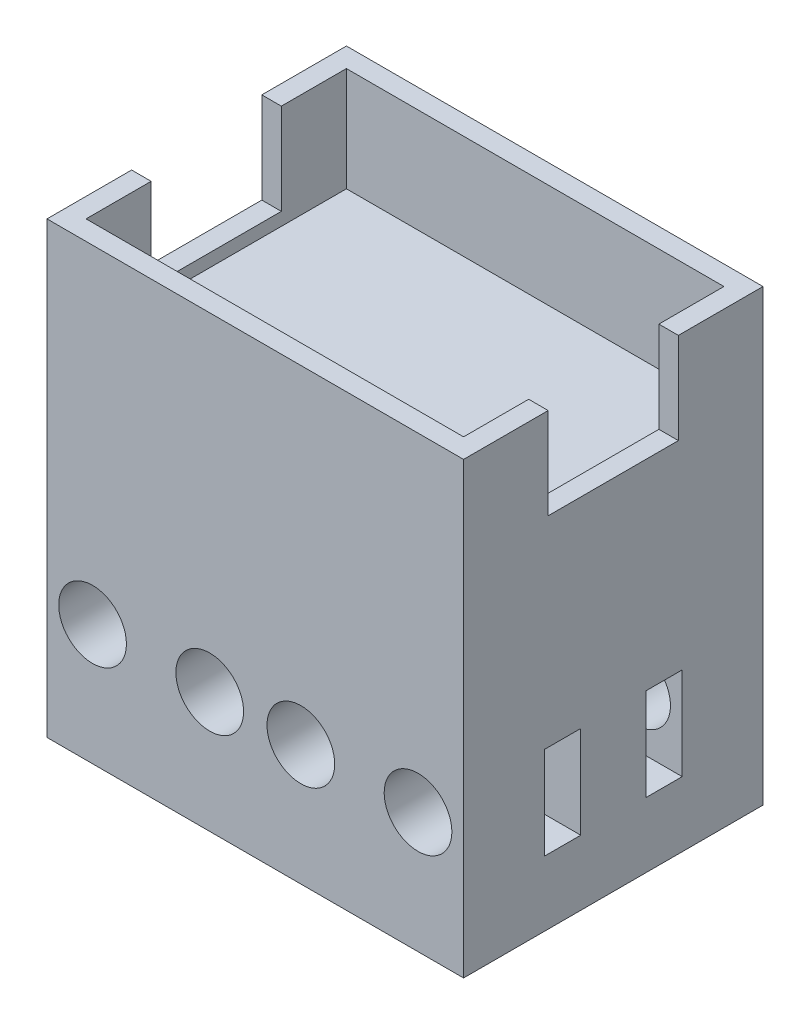
from build123d import *

# Parameters (mm, degrees)
SKETCH4_W           = 32
SKETCH4_H           = 23
BOSS_EXTRUDE3_DEPTH = 19.5
SKETCH5_W           = 29
SKETCH5_H           = 20
CUT_EXTRUDE2_DEPTH  = 8
SKETCH7_W           = 10
SKETCH7_H           = 7
CUT_EXTRUDE4_DEPTH  = 40.198214245
SKETCH8_W           = 32
SKETCH8_H           = 23
BOSS_EXTRUDE4_DEPTH = 10
SKETCH12_R          = 2.6
CUT_EXTRUDE5_DEPTH  = 7
CIRPATTERN1_COUNT   = 2
CIRPATTERN1_ANGLE   = 180
SKETCH13_W          = 15
SKETCH13_H          = 2.791622882
CUT_EXTRUDE6_DEPTH  = 7.1
SKETCH14_W          = 32
SKETCH14_H          = 23
BOSS_EXTRUDE5_DEPTH = 5


with BuildPart() as part:
    # Sketch4 → Boss-Extrude3 (new body)
    with BuildSketch(Plane(origin=(0, 0, 0), x_dir=(1, 0, 0), z_dir=(0, 1, 0))):
        Rectangle(SKETCH4_W, SKETCH4_H)
    extrude(amount=BOSS_EXTRUDE3_DEPTH)

    # Sketch5 → Cut-Extrude2 (cut)
    with BuildSketch(Plane(origin=(0, 19.5, 0), x_dir=(1, 0, 0), z_dir=(0, 1, 0))):
        Rectangle(SKETCH5_W, SKETCH5_H)
    extrude(amount=-CUT_EXTRUDE2_DEPTH, mode=Mode.SUBTRACT)

    # Sketch7 → Cut-Extrude4 (cut, through all)
    with BuildSketch(Plane(origin=(16, 0, 0), x_dir=(0, 0, -1), z_dir=(1, 0, 0))):
        with Locations((0, 16)):
            Rectangle(SKETCH7_W, SKETCH7_H)
    extrude(amount=-CUT_EXTRUDE4_DEPTH, mode=Mode.SUBTRACT)

    # Sketch8 → Boss-Extrude4 (add)
    with BuildSketch(Plane(origin=(0, 0, 0), x_dir=(-1, 0, 0), z_dir=(0, -1, 0))):
        Rectangle(SKETCH8_W, SKETCH8_H)
    extrude(amount=BOSS_EXTRUDE4_DEPTH)

    # Sketch12 → Cut-Extrude5 (cut)
    with BuildSketch(Plane(origin=(0, 0, -11.5), x_dir=(-1, 0, 0), z_dir=(0, 0, -1))):
        with Locations((-12.5, -5.726898225)):
            Circle(SKETCH12_R)
        with Locations((-3.5, -5.726898225)):
            Circle(SKETCH12_R)
        with Locations((3.5, -5.726898225)):
            Circle(SKETCH12_R)
        with Locations((12.5, -5.726898225)):
            Circle(SKETCH12_R)
    cut_extrude5 = extrude(amount=-CUT_EXTRUDE5_DEPTH, mode=Mode.SUBTRACT)

    # CirPattern1: Cut-Extrude5 ×2 about axis
    cirpattern1_axis = Axis((0, 11.5, 0), (0, 1, 0))
    for i in range(1, CIRPATTERN1_COUNT):
        add(cut_extrude5.rotate(cirpattern1_axis, i * CIRPATTERN1_ANGLE / (CIRPATTERN1_COUNT - 1)), mode=Mode.SUBTRACT)

    # Sketch13 → Cut-Extrude6 (cut)
    with BuildSketch(Plane(origin=(0, -10, 0), x_dir=(-1, 0, 0), z_dir=(0, -1, 0))):
        with Locations((8.5, 3.895811441)):
            Rectangle(SKETCH13_W, SKETCH13_H)
        with Locations((-8.5, 3.895811441)):
            Rectangle(SKETCH13_W, SKETCH13_H)
        with Locations((-8.5, -3.895811441)):
            Rectangle(SKETCH13_W, SKETCH13_H)
        with Locations((8.5, -3.895811441)):
            Rectangle(SKETCH13_W, SKETCH13_H)
    extrude(amount=-CUT_EXTRUDE6_DEPTH, mode=Mode.SUBTRACT)

    # Sketch14 → Boss-Extrude5 (add)
    with BuildSketch(Plane(origin=(0, -10, 0), x_dir=(-1, 0, 0), z_dir=(0, -1, 0))):
        Rectangle(SKETCH14_W, SKETCH14_H)
    extrude(amount=BOSS_EXTRUDE5_DEPTH)


solid = part.part
